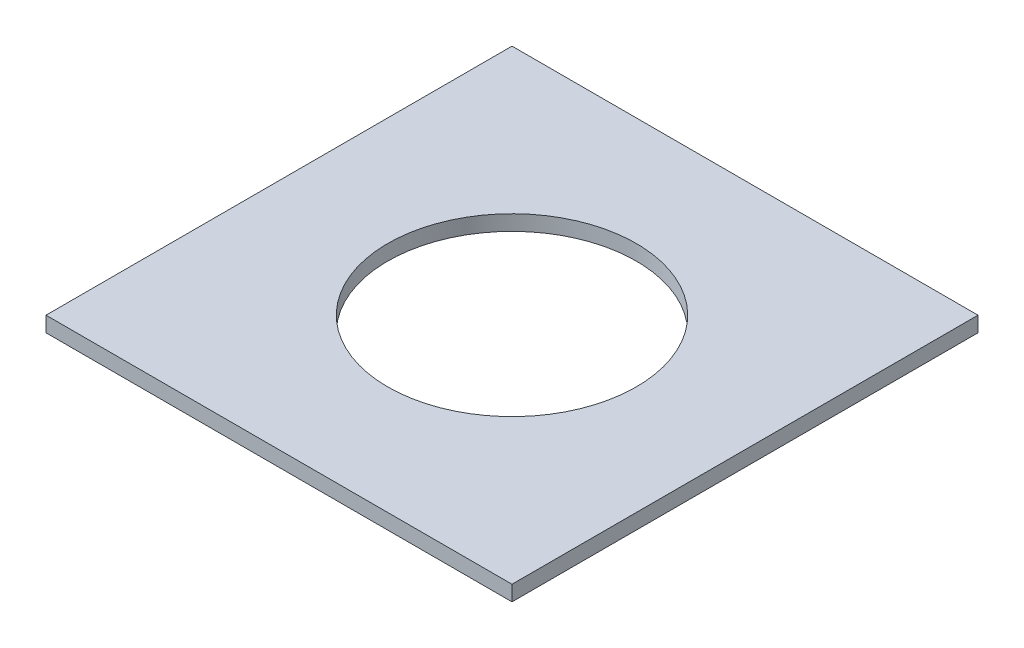
from build123d import *

# Parameters (mm, degrees)
SKETCH1_W           = 304.8
SKETCH1_H           = 304.8
BOSS_EXTRUDE1_DEPTH = 10
SKETCH5_R           = 81.2764
CUT_EXTRUDE4_DEPTH  = 216.758012597


with BuildPart() as part:
    # Sketch1 → Boss-Extrude1 (new body)
    with BuildSketch(Plane(origin=(0, 0, 0), x_dir=(1, 0, 0), z_dir=(0, 1, 0))):
        Rectangle(SKETCH1_W, SKETCH1_H)
    extrude(amount=BOSS_EXTRUDE1_DEPTH)

    # Sketch5 → Cut-Extrude4 (cut, through all)
    with BuildSketch(Plane(origin=(0, 10, 0), x_dir=(1, 0, 0), z_dir=(0, 1, 0))):
        Circle(SKETCH5_R)
    extrude(amount=-CUT_EXTRUDE4_DEPTH, mode=Mode.SUBTRACT)


solid = part.part
